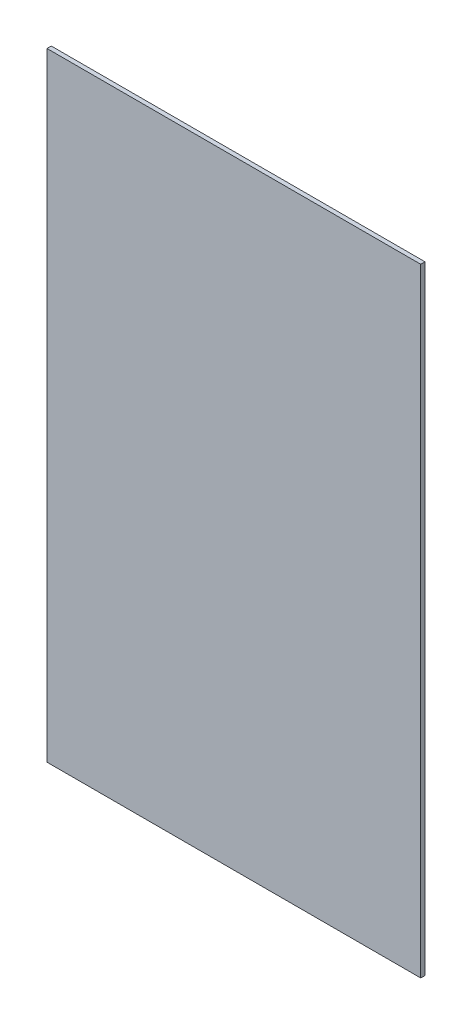
from build123d import *

# Parameters (mm, degrees)
SKETCH_1_W      = 524
SKETCH_1_H      = 866.6
EXTRUDE_1_DEPTH = 6


with BuildPart() as part:
    # Эскиз1 → Бобышка-Вытянуть1 (new body)
    with BuildSketch(Plane.XY):
        with Locations((-262, 3)):
            Rectangle(SKETCH_1_W, SKETCH_1_H)
    extrude(amount=-EXTRUDE_1_DEPTH)


solid = part.part
